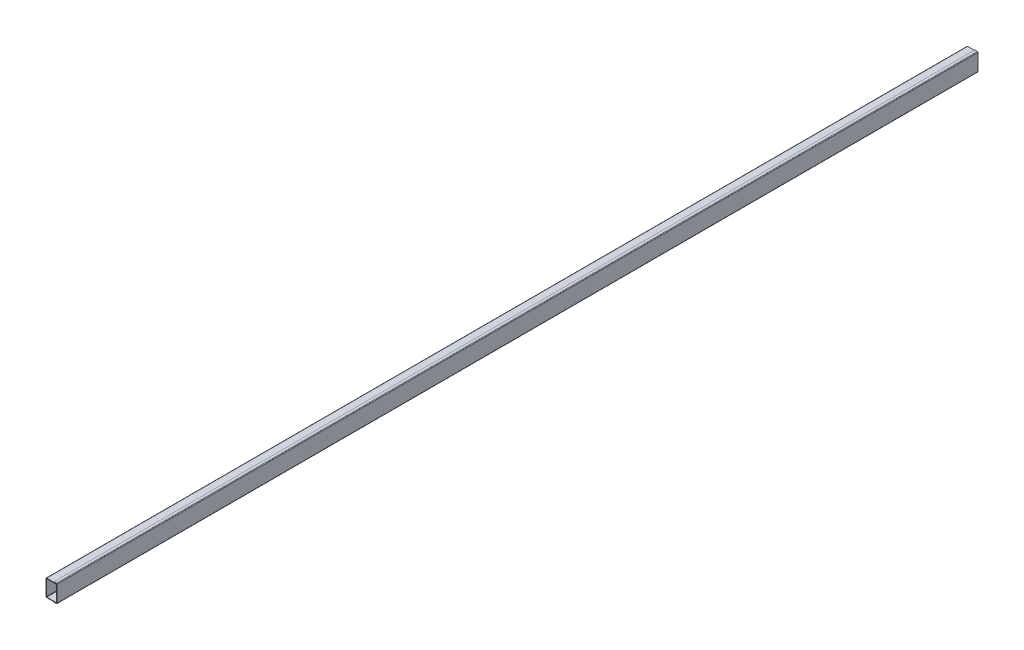
from build123d import *

# Parameters (mm, degrees)
SKETCH1_W                      = 4370
SKETCH1_H                      = 80
BASE_FLANGE1_DEPTH             = 2
EDGE_FLANGE1_STRIP_W           = 10
EDGE_FLANGE1_STRIP_H           = 2
EDGE_FLANGE1_STRIP_CUT_DEPTH   = 4370
EDGE_FLANGE1_STRIP_2_W         = 10
EDGE_FLANGE1_STRIP_2_H         = 2
EDGE_FLANGE1_STRIP_CUT_2_DEPTH = 4370
EDGE_FLANGE1_DEPTH             = 4370
EDGE_FLANGE1_BEND_DEPTH        = 4370
SKETCH13_W                     = 4370
SKETCH13_H                     = 80
BASE_FLANGE2_DEPTH             = 2
EDGE_FLANGE2_STRIP_W           = 10
EDGE_FLANGE2_STRIP_H           = 2
EDGE_FLANGE2_STRIP_CUT_DEPTH   = 4370
EDGE_FLANGE2_STRIP_2_W         = 10
EDGE_FLANGE2_STRIP_2_H         = 2
EDGE_FLANGE2_STRIP_CUT_2_DEPTH = 4370
EDGE_FLANGE2_DEPTH             = 4370
EDGE_FLANGE2_BEND_DEPTH        = 4370


# Sheet-metal steps are written as plain solids
with BuildPart() as part:
    # Sketch1 → Base-Flange1 (new body)
    with BuildSketch(Plane(origin=(0, 0, 0), x_dir=(0, 0, -1), z_dir=(1, 0, 0))):
        Rectangle(SKETCH1_W, SKETCH1_H)
    extrude(amount=BASE_FLANGE1_DEPTH)

    # Edge-Flange1 strip (across the edge) → Edge-Flange1 strip cut (cut)
    with BuildSketch(Plane(origin=(2, 40, -2185), x_dir=(0, -1, 0), z_dir=(0, 0, 1))):
        with Locations((-2, -1)):
            Rectangle(EDGE_FLANGE1_STRIP_W, EDGE_FLANGE1_STRIP_H)
    extrude(amount=EDGE_FLANGE1_STRIP_CUT_DEPTH, mode=Mode.SUBTRACT)

    # Edge-Flange1 strip 2 (across the edge) → Edge-Flange1 strip cut 2 (cut)
    with BuildSketch(Plane(origin=(2, -40, 2185), x_dir=(0, 1, 0), z_dir=(0, 0, -1))):
        with Locations((-2, -1)):
            Rectangle(EDGE_FLANGE1_STRIP_2_W, EDGE_FLANGE1_STRIP_2_H)
    extrude(amount=EDGE_FLANGE1_STRIP_CUT_2_DEPTH, mode=Mode.SUBTRACT)

    # Edge-Flange1 section (across the edge) → Edge-Flange1 (add)
    with BuildSketch(Plane(origin=(2, 40, -2185), x_dir=(0, -1, 0), z_dir=(0, 0, 1))):
        with BuildLine():
            Line((0, 1), (0, 48))
            Line((0, 48), (2, 48))
            Line((2, 48), (2, 1))
            ThreePointArc((2, 1), (2.292893219, 0.292893219), (3, 0))
            Line((3, 0), (3, -2))
            ThreePointArc((3, -2), (0.878679656, -1.121320344), (0, 1))
        make_face()
    extrude(amount=EDGE_FLANGE1_DEPTH)

    # Edge-Flange1 section 2 (across the edge) → Edge-Flange1 bend (add)
    with BuildSketch(Plane(origin=(2, -40, 2185), x_dir=(0, 1, 0), z_dir=(0, 0, -1))):
        with BuildLine():
            Line((0, 1), (0, 48))
            Line((0, 48), (2, 48))
            Line((2, 48), (2, 1))
            ThreePointArc((2, 1), (2.292893219, 0.292893219), (3, 0))
            Line((3, 0), (3, -2))
            ThreePointArc((3, -2), (0.878679656, -1.121320344), (0, 1))
        make_face()
    extrude(amount=EDGE_FLANGE1_BEND_DEPTH)


with BuildPart() as body_2:
    # Sketch13 → Base-Flange2 (new body)
    with BuildSketch(Plane(origin=(50, 0, 0), x_dir=(0, 0, -1), z_dir=(1, 0, 0))):
        Rectangle(SKETCH13_W, SKETCH13_H)
    extrude(amount=BASE_FLANGE2_DEPTH)

    # Edge-Flange2 strip (across the edge) → Edge-Flange2 strip cut (cut)
    with BuildSketch(Plane(origin=(50, 40, 2185), x_dir=(0, -1, 0), z_dir=(0, 0, -1))):
        with Locations((-4, -1)):
            Rectangle(EDGE_FLANGE2_STRIP_W, EDGE_FLANGE2_STRIP_H)
    extrude(amount=EDGE_FLANGE2_STRIP_CUT_DEPTH, mode=Mode.SUBTRACT)

    # Edge-Flange2 strip 2 (across the edge) → Edge-Flange2 strip cut 2 (cut)
    with BuildSketch(Plane(origin=(50, -40, -2185), x_dir=(0, 1, 0), z_dir=(0, 0, 1))):
        with Locations((-4, -1)):
            Rectangle(EDGE_FLANGE2_STRIP_2_W, EDGE_FLANGE2_STRIP_2_H)
    extrude(amount=EDGE_FLANGE2_STRIP_CUT_2_DEPTH, mode=Mode.SUBTRACT)

    # Edge-Flange2 section (across the edge) → Edge-Flange2 (add)
    with BuildSketch(Plane(origin=(50, 40, 2185), x_dir=(0, -1, 0), z_dir=(0, 0, -1))):
        with BuildLine():
            Line((-2, 1), (-2, 13))
            Line((-2, 13), (0, 13))
            Line((0, 13), (0, 1))
            ThreePointArc((0, 1), (0.292893219, 0.292893219), (1, 0))
            Line((1, 0), (1, -2))
            ThreePointArc((1, -2), (-1.121320344, -1.121320344), (-2, 1))
        make_face()
    extrude(amount=EDGE_FLANGE2_DEPTH)

    # Edge-Flange2 section 2 (across the edge) → Edge-Flange2 bend (add)
    with BuildSketch(Plane(origin=(50, -40, -2185), x_dir=(0, 1, 0), z_dir=(0, 0, 1))):
        with BuildLine():
            Line((-2, 1), (-2, 13))
            Line((-2, 13), (0, 13))
            Line((0, 13), (0, 1))
            ThreePointArc((0, 1), (0.292893219, 0.292893219), (1, 0))
            Line((1, 0), (1, -2))
            ThreePointArc((1, -2), (-1.121320344, -1.121320344), (-2, 1))
        make_face()
    extrude(amount=EDGE_FLANGE2_BEND_DEPTH)


solid = Compound([part.part, body_2.part])
